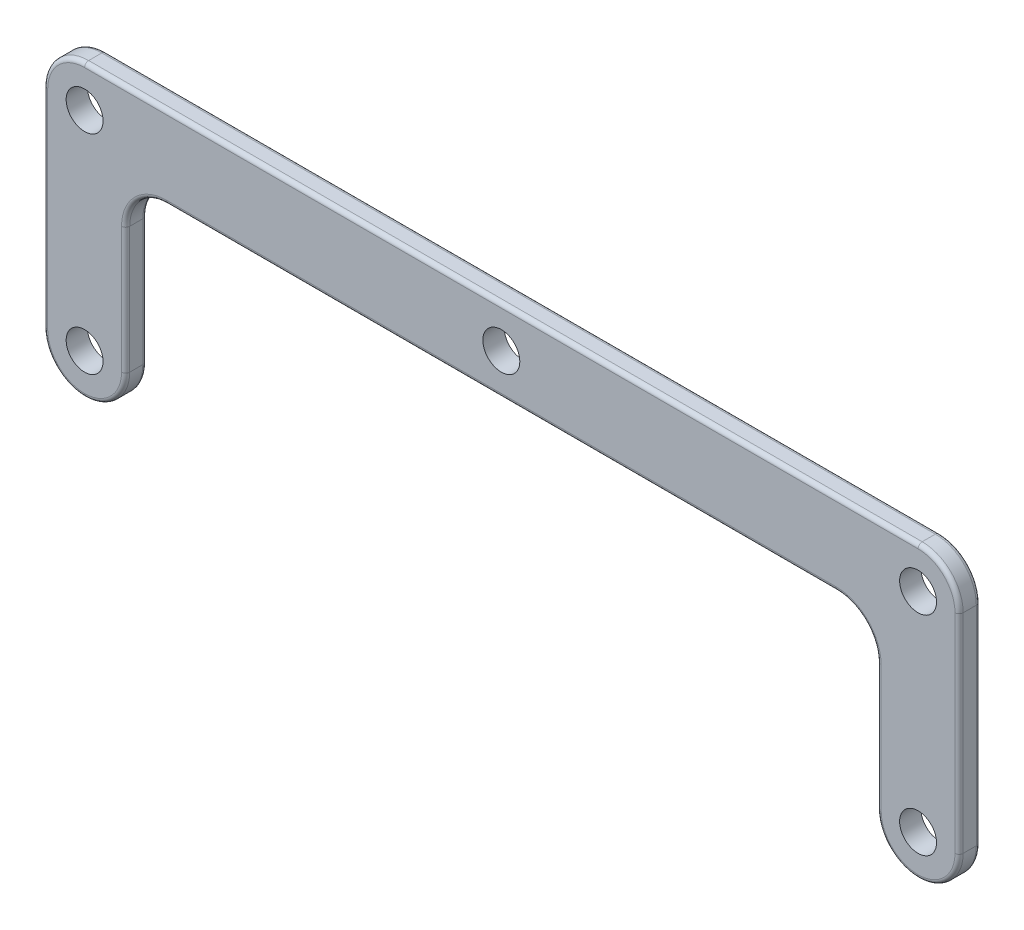
from build123d import *

# Parameters (mm, degrees)
SKETCH1_R           = 2.25
BOSS_EXTRUDE1_DEPTH = 2.6
FILLET1_R           = 5
FILLET2_R           = 0.5


with BuildPart() as part:
    # Sketch1 → Boss-Extrude1 (new body)
    with BuildSketch(Plane.XY):
        Polygon((-5, 5), (-5, -30.4), (5, -30.4), (5, -5), (96.6, -5), (96.6, -30.4), (106.6, -30.4), (106.6, 5), align=None)
        Circle(SKETCH1_R, mode=Mode.SUBTRACT)
        with Locations((101.6, 0)):
            Circle(SKETCH1_R, mode=Mode.SUBTRACT)
        with Locations((0, -25.4)):
            Circle(SKETCH1_R, mode=Mode.SUBTRACT)
        with Locations((101.6, -25.4)):
            Circle(SKETCH1_R, mode=Mode.SUBTRACT)
        with Locations((50.8, 0)):
            Circle(SKETCH1_R, mode=Mode.SUBTRACT)
    extrude(amount=BOSS_EXTRUDE1_DEPTH)

    # Fillet1
    fillet1_edges = [part.edges().sort_by_distance(p)[0] for p in [
        (96.6, -30.4, 1.3),
        (106.6, -30.4, 1.3),
        (106.6, 5, 1.3),
        (96.6, -5, 1.3),
        (-5, 5, 1.3),
        (-5, -30.4, 1.3),
        (5, -30.4, 1.3),
        (5, -5, 1.3),
    ]]
    fillet(fillet1_edges, radius=FILLET1_R - 0.0001)  # a hair under: the kernel refuses the full size

    # Fillet2
    fillet2_edges = [part.edges().sort_by_distance(p)[0] for p in [
        (96.6, -17.7, 0),
        (50.8, -5, 0),
        (5, -17.7, 0),
        (-5, -12.7, 0),
        (50.8, 5, 0),
        (106.6, -12.7, 0),
        (3.535563195, -28.935563195, 0),
        (-3.535563195, -28.935563195, 0),
        (-3.535563195, 3.535563195, 0),
        (105.135563195, 3.535563195, 0),
        (105.135563195, -28.935563195, 0),
        (98.064436805, -28.935563195, 0),
        (96.6, -17.7, 2.6),
        (106.6, -12.7, 2.6),
        (50.8, 5, 2.6),
        (-5, -12.7, 2.6),
        (5, -17.7, 2.6),
        (50.8, -5, 2.6),
        (3.535563195, -28.935563195, 2.6),
        (-3.535563195, -28.935563195, 2.6),
        (-3.535563195, 3.535563195, 2.6),
        (105.135563195, 3.535563195, 2.6),
        (105.135563195, -28.935563195, 2.6),
        (98.064436805, -28.935563195, 2.6),
        (95.135563195, -6.464436805, 0),
        (95.135563195, -6.464436805, 2.6),
        (6.464436805, -6.464436805, 0),
        (6.464436805, -6.464436805, 2.6),
    ]]
    fillet(fillet2_edges, radius=FILLET2_R)


solid = part.part
